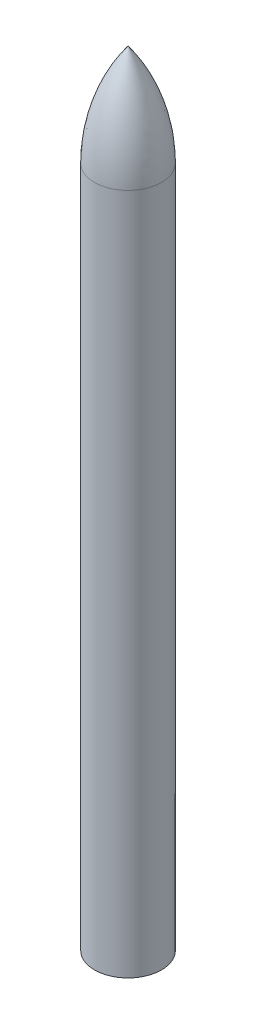
from build123d import *


with BuildPart() as part:
    # Sketch3 → Revolve1 (revolve)
    with BuildSketch(Plane.XY):
        with BuildLine():
            Line((-137.16, 0), (-137.16, 2794))
            ThreePointArc((-137.16, 2794), (-101.983696426, 3012.797669969), (0, 3209.544))
            Line((0, 3209.544), (0, 3204.188084961))
            ThreePointArc((0, 3204.188084961), (-99.639981102, 3009.758108346), (-133.985, 2794))
            Line((-133.985, 2794), (-133.985, 0))
            Line((-133.985, 0), (-137.16, 0))
        make_face()
    revolve(axis=Axis((0, 0, 0), (0, 1, 0)))


solid = part.part
